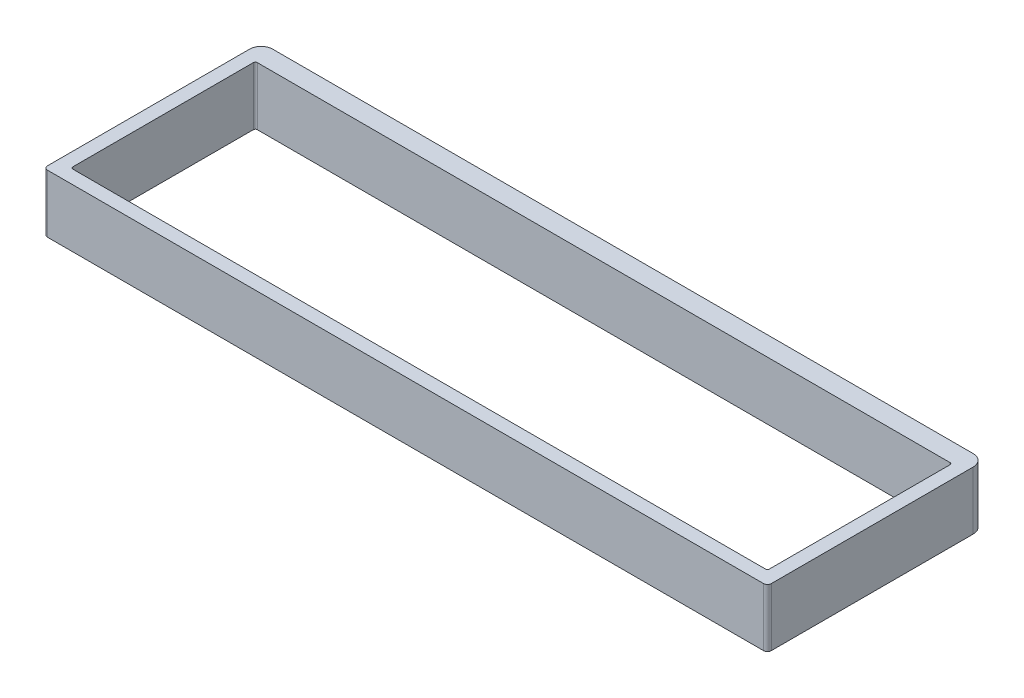
from build123d import *

# Parameters (mm, degrees)
BOSS_EXTRUDE1_DEPTH = 30


with BuildPart() as part:
    # Sketch2 → Boss-Extrude1 (new body)
    with BuildSketch(Plane(origin=(0, 0, 0), x_dir=(1, 0, 0), z_dir=(0, 1, 0))):
        with BuildLine():
            Line((180.825, 57.625), (-180.825, 57.625))
            ThreePointArc((-180.825, 57.625), (-185.067640687, 55.867640687), (-186.825, 51.625))
            Line((-186.825, 51.625), (-186.825, -52.625))
            ThreePointArc((-186.825, -52.625), (-186.239213562, -54.039213562), (-184.825, -54.625))
            Line((-184.825, -54.625), (184.825, -54.625))
            ThreePointArc((184.825, -54.625), (186.239213562, -54.039213562), (186.825, -52.625))
            Line((186.825, -52.625), (186.825, 51.625))
            ThreePointArc((186.825, 51.625), (185.067640687, 55.867640687), (180.825, 57.625))
        make_face()
        with BuildLine():
            Line((-179.825, -46.625), (-179.825, 46.625))
            ThreePointArc((-179.825, 46.625), (-179.532106781, 47.332106781), (-178.825, 47.625))
            Line((-178.825, 47.625), (178.825, 47.625))
            ThreePointArc((178.825, 47.625), (179.532106781, 47.332106781), (179.825, 46.625))
            Line((179.825, 46.625), (179.825, -46.625))
            ThreePointArc((179.825, -46.625), (179.532106781, -47.332106781), (178.825, -47.625))
            Line((178.825, -47.625), (-178.825, -47.625))
            ThreePointArc((-178.825, -47.625), (-179.532106781, -47.332106781), (-179.825, -46.625))
        make_face(mode=Mode.SUBTRACT)
    extrude(amount=BOSS_EXTRUDE1_DEPTH)


solid = part.part
